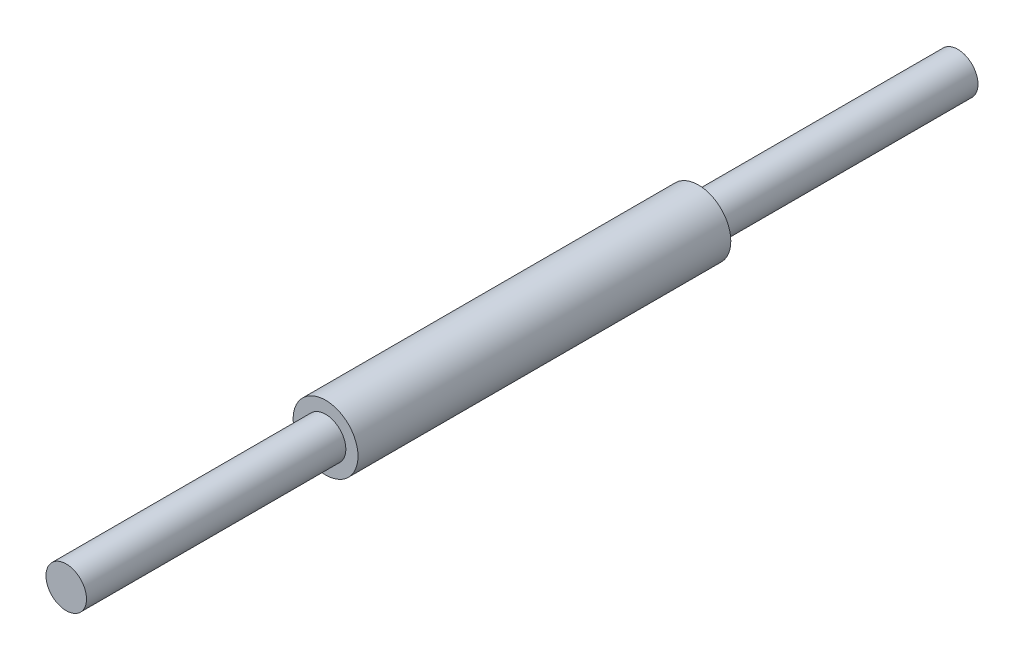
from build123d import *

# Parameters (mm, degrees)
BOSS_EXTRUDE1_DEPTH      = 69.85
BOSS_EXTRUDE1_DEPTH_BACK = 69.85
SKETCH2_R                = 3.175
BOSS_EXTRUDE2_DEPTH      = 29.21
BOSS_EXTRUDE2_DEPTH_BACK = 29.21
SKETCH3_R                = 5.08


with BuildPart() as part:
    # Sketch2 → Boss-Extrude1 (new, two sides: drawn at the far end of the back side and taken through both)
    with BuildSketch(Plane.XY.offset(-BOSS_EXTRUDE1_DEPTH_BACK)):
        Circle(SKETCH2_R)
    extrude(amount=BOSS_EXTRUDE1_DEPTH + BOSS_EXTRUDE1_DEPTH_BACK)

    # Sketch3 → Boss-Extrude2 (add, two sides: drawn at the far end of the back side and taken through both)
    with BuildSketch(Plane.XY.offset(-BOSS_EXTRUDE2_DEPTH_BACK)):
        Circle(SKETCH3_R)
    extrude(amount=BOSS_EXTRUDE2_DEPTH + BOSS_EXTRUDE2_DEPTH_BACK)


solid = part.part
